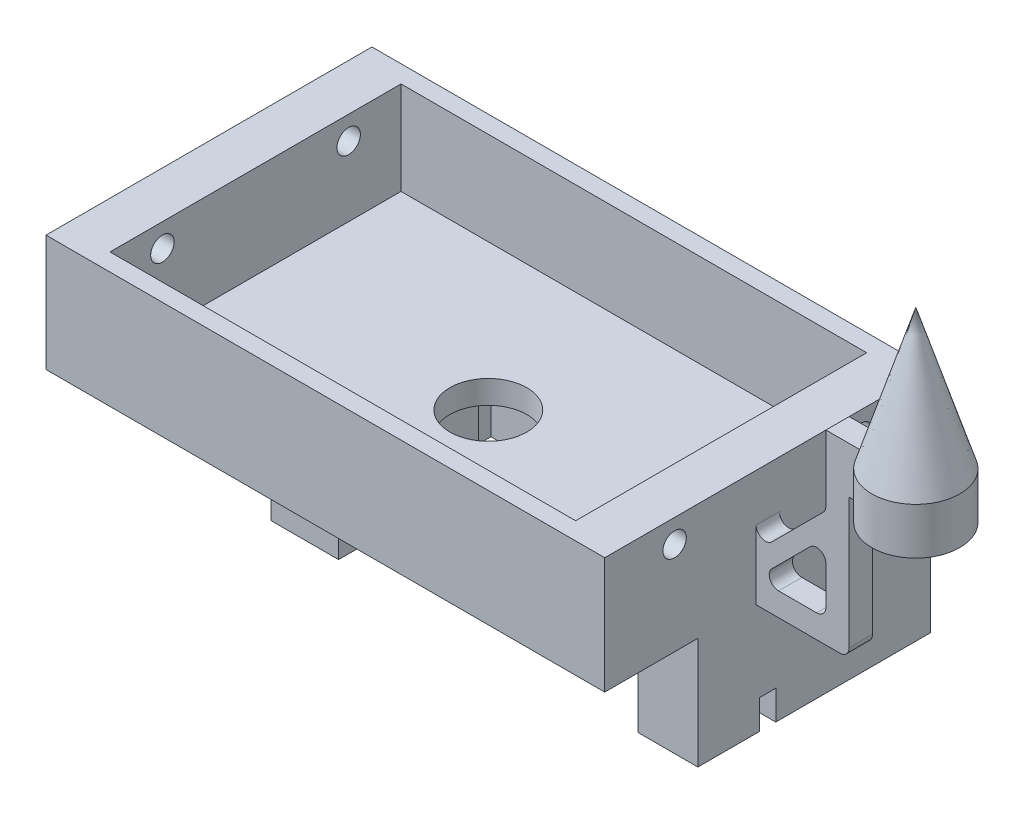
from build123d import *

# Parameters (mm, degrees)
SKETCH1_W                = 63.5
SKETCH1_H                = 38.1
BASE_DEPTH               = 3.175
SKETCH3_W                = 6.35
SKETCH3_H                = 38.1
ROD_HOLDER_DEPTH         = 15.875
SKETCH4_R                = 1.6
ROD_HOLE_DEPTH           = 87.660634806
SKETCH7_R                = 5.25
GEARPINHOLE_10_5MM_DEPTH = 81.572467382
SKETCH9_W                = 76.2
SKETCH9_H                = 3.175
BOSS_EXTRUDE1_DEPTH      = 15.875
SKETCH11_W               = 8.195400186
SKETCH11_H               = 19.05
BOSS_EXTRUDE2_DEPTH      = 15.2
SKETCH20_W               = 1
SKETCH20_H               = 19.05
BOSS_EXTRUDE7_DEPTH      = 15.2
SKETCH12_R               = 1.5
CUT_EXTRUDE1_DEPTH       = 8.89
BOSS_EXTRUDE3_DEPTH      = 15.2
SKETCH14_R               = 1.75
CUT_EXTRUDE2_DEPTH       = 6.858
SKETCH15_W               = 63.5
SKETCH15_H               = 0.79375
CUT_EXTRUDE3_DEPTH       = 12.7
SKETCH16_W               = 9.195400186
SKETCH16_H               = 2.2
SKETCH16_W_2             = 8.195400186
CUT_EXTRUDE4_DEPTH       = 4
BOSS_EXTRUDE4_DEPTH      = 1.5875
BOSS_EXTRUDE4_DEPTH_BACK = 1.5875
BOSS_EXTRUDE4_START      = -22.225
SKETCH18_R               = 5
BOSS_EXTRUDE5_DEPTH      = 6.35
BOSS_EXTRUDE6_DEPTH      = 3.175
FILLET1_R                = 1.27
FILLET2_R                = 1.27
SKETCH21_R               = 5
BOSS_EXTRUDE8_DEPTH      = 6.35


with BuildPart() as part:
    # Sketch1 → Base (new body)
    with BuildSketch(Plane(origin=(0, 0, 0), x_dir=(1, 0, 0), z_dir=(0, 1, 0))):
        with Locations((31.75, 19.05)):
            Rectangle(SKETCH1_W, SKETCH1_H)
    extrude(amount=BASE_DEPTH)

    # Sketch3 → Rod Holder (add)
    with BuildSketch(Plane(origin=(0, 0, 0), x_dir=(1, 0, 0), z_dir=(0, 1, 0))):
        with Locations((-3.175, 19.05)):
            Rectangle(SKETCH3_W, SKETCH3_H)
        with Locations((66.675, 19.05)):
            Rectangle(SKETCH3_W, SKETCH3_H)
    extrude(amount=ROD_HOLDER_DEPTH)

    # Sketch4 → Rod Hole (cut, through all)
    with BuildSketch(Plane(origin=(69.85, 0, 0), x_dir=(0, 0, -1), z_dir=(1, 0, 0))):
        with Locations((6.35, 12.7)):
            Circle(SKETCH4_R)
        with Locations((31.75, 12.7)):
            Circle(SKETCH4_R)
    extrude(amount=-ROD_HOLE_DEPTH, mode=Mode.SUBTRACT)

    # Sketch7 → GearPinHole_10.5mm (cut, through all)
    with BuildSketch(Plane(origin=(0, 3.175, 0), x_dir=(1, 0, 0), z_dir=(0, 1, 0))):
        with Locations(Location((31.75, 19.05, 0), (0, 0, 270))):
            Circle(SKETCH7_R)
    extrude(amount=-GEARPINHOLE_10_5MM_DEPTH, mode=Mode.SUBTRACT)

    # Sketch9 → Boss-Extrude1 (add)
    with BuildSketch(Plane.XZ):
        with Locations((31.75, 1.5875)):
            Rectangle(SKETCH9_W, SKETCH9_H)
        with Locations((31.75, -39.6875)):
            Rectangle(SKETCH9_W, SKETCH9_H)
    extrude(amount=-BOSS_EXTRUDE1_DEPTH)

    # Sketch11 → Boss-Extrude2 (add)
    with BuildSketch(Plane.XZ):
        with Locations((15.752300005, -19.05)):
            Rectangle(SKETCH11_W, SKETCH11_H)
        with Locations((65.752299907, -19.05)):
            Rectangle(SKETCH11_W, SKETCH11_H)
    extrude(amount=BOSS_EXTRUDE2_DEPTH)

    # Sketch20 → Boss-Extrude7 (add)
    with BuildSketch(Plane.XZ):
        with Locations((20.350000098, -19.05)):
            Rectangle(SKETCH20_W, SKETCH20_H)
    extrude(amount=BOSS_EXTRUDE7_DEPTH)

    # Sketch12 → Cut-Extrude1 (cut)
    with BuildSketch(Plane.XZ.offset(15.2)):
        with Locations(Location((17.75230014, -14.05, 0), (0, 0, 270))):
            Circle(SKETCH12_R)
        with Locations(Location((17.75230014, -24.05, 0), (0, 0, 270))):
            Circle(SKETCH12_R)
        with Locations(Location((65.752299962, -24.05, 0), (0, 0, 270))):
            Circle(SKETCH12_R)
        with Locations(Location((65.752299962, -14.05, 0), (0, 0, 270))):
            Circle(SKETCH12_R)
    extrude(amount=-CUT_EXTRUDE1_DEPTH, mode=Mode.SUBTRACT)

    # Sketch13 → Boss-Extrude3 (add)
    with BuildSketch(Plane.XZ):
        Polygon((11.654599912, -28.575), (16.734599912, -28.575), (16.734599912, -34.417), (64.77, -34.417), (64.77, -28.575), (69.85, -28.575), (69.85, -41.275), (11.654599912, -41.275), align=None)
    extrude(amount=BOSS_EXTRUDE3_DEPTH)

    # Sketch14 → Cut-Extrude2 (cut)
    with BuildSketch(Plane(origin=(0, 0, -41.275), x_dir=(-1, 0, 0), z_dir=(0, 0, -1))):
        with Locations((-53.752299956, -7.6)):
            Circle(SKETCH14_R)
        with Locations((-27.752299956, -7.6)):
            Circle(SKETCH14_R)
    extrude(amount=-CUT_EXTRUDE2_DEPTH, mode=Mode.SUBTRACT)

    # Sketch15 → Cut-Extrude3 (cut)
    with BuildSketch(Plane(origin=(0, 15.875, 0), x_dir=(1, 0, 0), z_dir=(0, 1, 0))):
        with Locations((31.75, 38.496875)):
            Rectangle(SKETCH15_W, SKETCH15_H)
        with Locations((31.75, -0.396875)):
            Rectangle(SKETCH15_W, SKETCH15_H)
    extrude(amount=-CUT_EXTRUDE3_DEPTH, mode=Mode.SUBTRACT)

    # Sketch16 → Cut-Extrude4 (cut)
    with BuildSketch(Plane.XZ.offset(15.2)):
        with Locations((16.252300005, -19.05)):
            Rectangle(SKETCH16_W, SKETCH16_H)
        with Locations((65.752299907, -19.05)):
            Rectangle(SKETCH16_W_2, SKETCH16_H)
    extrude(amount=-CUT_EXTRUDE4_DEPTH, mode=Mode.SUBTRACT)

    # Sketch17 → Boss-Extrude4 (add, two sides: drawn at the far end of the back side and taken through both)
    with BuildSketch(Plane(origin=(0, 0, -41.275), x_dir=(-1, 0, 0), z_dir=(0, 0, -1)).offset(BOSS_EXTRUDE4_START - BOSS_EXTRUDE4_DEPTH_BACK)):
        Polygon((-69.85, 0), (-82.55, 0), (-82.55, 25.4), (-79.375, 25.4), (-79.375, 3.175), (-69.85, 3.175), align=None)
    extrude(amount=BOSS_EXTRUDE4_DEPTH + BOSS_EXTRUDE4_DEPTH_BACK)

    # Sketch18 → Boss-Extrude5 (add)
    with BuildSketch(Plane(origin=(0, 25.4, 0), x_dir=(1, 0, 0), z_dir=(0, 1, 0))):
        with BuildLine():
            Line((82.55, 20.6375), (84.263823045, 20.6375))
            ThreePointArc((84.263823045, 20.6375), (96.05, 19.05), (84.263823045, 17.4625))
            Line((84.263823045, 17.4625), (82.55, 17.4625))
            Line((82.55, 17.4625), (82.55, 20.6375))
        make_face()
        with Locations(Location((90.05, 19.05, 0), (0, 0, 180))):
            Circle(SKETCH18_R, mode=Mode.SUBTRACT)
    extrude(amount=-BOSS_EXTRUDE5_DEPTH)

    # Sketch19 → Boss-Extrude6 (add)
    with BuildSketch(Plane(origin=(0, 0, -20.6375), x_dir=(-1, 0, 0), z_dir=(0, 0, -1))):
        Polygon((-79.375, 15.875), (-69.85, 6.35), (-69.85, 3.175), (-79.375, 12.7), align=None)
    extrude(amount=-BOSS_EXTRUDE6_DEPTH)

    # Fillet1
    fillet1_edges = [part.edges().sort_by_distance(p)[0] for p in [
        (82.55, 0, -19.05),
        (79.375, 3.175, -19.05),
        (79.375, 12.7, -19.05),
        (79.375, 15.875, -19.05),
        (69.85, 6.35, -19.05),
    ]]
    fillet(fillet1_edges, radius=FILLET1_R)

    # Fillet2
    # the kernel refuses this fillet: 1.27 mm, written as the material it adds along each edge
    with BuildSketch(Plane(origin=(69.85, 3.175, -17.4625), x_dir=(1, 0, 0), z_dir=(0, 0, -1))) as fillet2_piece_1:
        with BuildLine():
            CenterArc((FILLET2_R * 2.41421356237, -FILLET2_R), FILLET2_R, 90, 135)
            Line((FILLET2_R * 1.70710678119, -FILLET2_R * 1.70710678119), (0, 0))
            Line((0, 0), (FILLET2_R * 2.41421356237, 0))
        make_face()
    extrude(amount=3.175)

    # Sketch21 → Boss-Extrude8 (add)
    with BuildSketch(Plane(origin=(0, 25.4, 0), x_dir=(1, 0, 0), z_dir=(0, 1, 0))):
        with Locations((90.05, 19.05)):
            Circle(SKETCH21_R)
    extrude(amount=-BOSS_EXTRUDE8_DEPTH)

    # Sketch22 → Revolve1 (revolve)
    with BuildSketch(Plane.XY.offset(-19.05), mode=Mode.PRIVATE) as revolve1_sk:
        Polygon((90.05, 25.4), (90.05, 44.45), (96.05, 25.4), align=None)
    revolve(revolve1_sk.sketch.rotate(Axis((90.05, 25.4, -19.05), (0, 1, 0)), 90), axis=Axis((90.05, 25.4, -19.05), (0, 1, 0)))


solid = part.part
